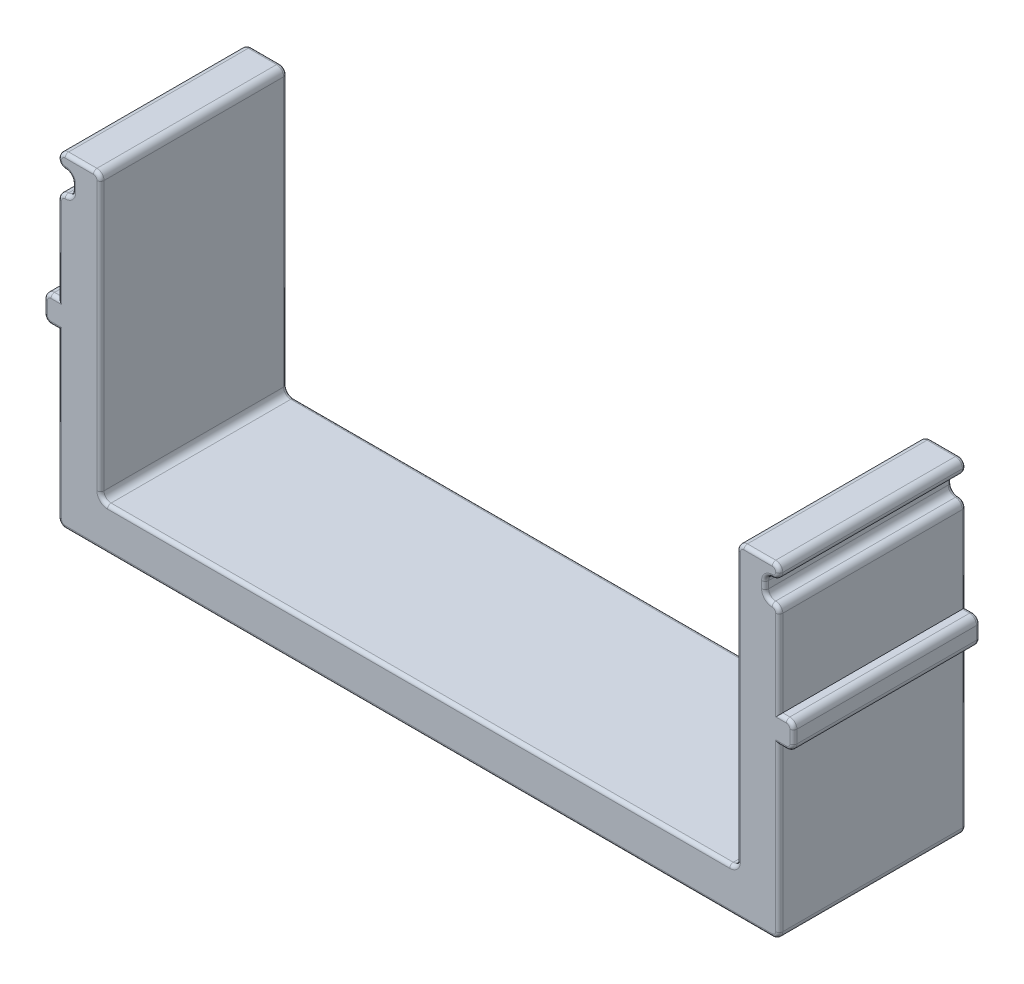
from build123d import *

# Parameters (mm, degrees)
BOSS_EXTRUDE1_DEPTH = 13.2
FILLET1_R           = 0.5
FILLET2_R           = 0.25


with BuildPart() as part:
    # Sketch1 → Boss-Extrude1 (new body)
    with BuildSketch(Plane.XY):
        Polygon((25.5, -2), (-25.5, -2), (-25.5, 10), (-26.5, 10), (-26.5, 11.9), (-25.5, 11.9), (-25.5, 18.5), (-24.5, 18.5), (-24.5, 20), (-25.5, 20), (-25.5, 21), (-22.5, 21), (-22.5, 1), (22.5, 1), (22.5, 21), (25.5, 21), (25.5, 20), (24.5, 20), (24.5, 18.5), (25.5, 18.5), (25.5, 11.9), (26.5, 11.9), (26.5, 10), (25.5, 10), align=None)
    extrude(amount=BOSS_EXTRUDE1_DEPTH)

    # Fillet1
    fillet1_edges = [part.edges().sort_by_distance(p)[0] for p in [
        (-25.5, 21, 6.6),
        (-25.5, 20, 6.6),
        (-24.5, 20, 6.6),
        (-25.5, 18.5, 6.6),
        (-24.5, 18.5, 6.6),
        (25.5, 18.5, 6.6),
        (24.5, 18.5, 6.6),
        (24.5, 20, 6.6),
        (25.5, 20, 6.6),
        (25.5, 21, 6.6),
        (-22.5, 21, 6.6),
        (22.5, 21, 6.6),
        (22.5, 1, 6.6),
        (-22.5, 1, 6.6),
        (25.5, -2, 6.6),
        (-25.5, -2, 6.6),
        (-26.5, 10, 6.6),
        (-26.5, 11.9, 6.6),
        (26.5, 10, 6.6),
        (26.5, 11.9, 6.6),
    ]]
    fillet(fillet1_edges, radius=FILLET1_R - 0.0001)  # a hair under: the kernel refuses the full size

    # Fillet2
    fillet2_edges = [part.edges().sort_by_distance(p)[0] for p in [
        (-25.35358268, 20.85358268, 13.2),
        (-24.64641732, 19.85358268, 0),
        (-24.64641732, 19.85358268, 13.2),
        (-24.64641732, 18.64641732, 0),
        (-24.64641732, 18.64641732, 13.2),
        (24.64641732, 18.64641732, 0),
        (24.64641732, 18.64641732, 13.2),
        (24.64641732, 19.85358268, 0),
        (24.64641732, 19.85358268, 13.2),
        (22.35358268, 1.14641732, 0),
        (22.35358268, 1.14641732, 13.2),
        (-22.35358268, 1.14641732, 0),
        (-22.35358268, 1.14641732, 13.2),
        (25.75005, 10, 13.2),
        (-25.75005, 11.9, 0),
        (25.5, 14.95005, 13.2),
        (25.5, 14.95005, 0),
        (25.75005, 10, 0),
        (-25.5, 4.24995, 0),
        (-25.75005, 10, 0),
        (-26.5, 10.95, 0),
        (-25.5, 14.95005, 0),
        (-24.5, 19.25, 0),
        (-24, 21, 0),
        (-22.5, 11, 0),
        (0, 1, 0),
        (-25.5, 4.24995, 13.2),
        (-25.75005, 11.9, 13.2),
        (22.5, 11, 0),
        (24, 21, 0),
        (24.5, 19.25, 0),
        (25.75005, 11.9, 0),
        (26.5, 10.95, 0),
        (25.5, 4.24995, 0),
        (0, -2, 0),
        (26.35358268, 11.75358268, 0),
        (26.35358268, 10.14641732, 0),
        (-26.35358268, 11.75358268, 0),
        (-26.35358268, 10.14641732, 0),
        (-25.35358268, -1.85358268, 0),
        (25.35358268, -1.85358268, 0),
        (22.64641732, 20.85358268, 0),
        (-22.64641732, 20.85358268, 0),
        (25.35358268, 20.85358268, 0),
        (25.35358268, 20.14641732, 0),
        (25.35358268, 18.35358268, 0),
        (-25.35358268, 18.35358268, 0),
        (-25.35358268, 20.14641732, 0),
        (-25.35358268, 20.85358268, 0),
        (-24, 21, 13.2),
        (-25.75005, 10, 13.2),
        (0, -2, 13.2),
        (25.5, 4.24995, 13.2),
        (26.5, 10.95, 13.2),
        (25.75005, 11.9, 13.2),
        (24.5, 19.25, 13.2),
        (24, 21, 13.2),
        (22.5, 11, 13.2),
        (0, 1, 13.2),
        (-22.5, 11, 13.2),
        (-24.5, 19.25, 13.2),
        (-25.5, 14.95005, 13.2),
        (-26.5, 10.95, 13.2),
        (26.35358268, 11.75358268, 13.2),
        (26.35358268, 10.14641732, 13.2),
        (-26.35358268, 11.75358268, 13.2),
        (-26.35358268, 10.14641732, 13.2),
        (-25.35358268, -1.85358268, 13.2),
        (25.35358268, -1.85358268, 13.2),
        (22.64641732, 20.85358268, 13.2),
        (-22.64641732, 20.85358268, 13.2),
        (25.35358268, 20.85358268, 13.2),
        (25.35358268, 20.14641732, 13.2),
        (25.35358268, 18.35358268, 13.2),
        (-25.35358268, 18.35358268, 13.2),
        (-25.35358268, 20.14641732, 13.2),
    ]]
    fillet(fillet2_edges, radius=FILLET2_R)


solid = part.part
